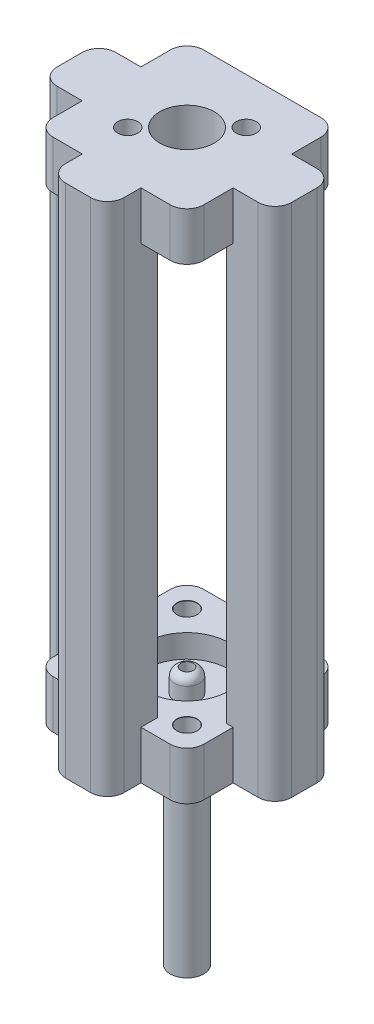
from build123d import *

# Parameters (mm, degrees)
SKETCH1_W                      = 18
SKETCH1_H                      = 18
BOSS_EXTRUDE1_DEPTH            = 5.75
M2_CLEARANCE_HOLE1_D           = 2.4
M2_CLEARANCE_HOLE1_CSINK_D     = 2.45
M2_CLEARANCE_HOLE1_CSINK_ANGLE = 90
SKETCH5_W                      = 5.8
SKETCH5_H                      = 7
BOSS_EXTRUDE2_DEPTH            = 50
SKETCH6_R                      = 4.0625
CUT_EXTRUDE1_DEPTH             = 5.75
SKETCH7_R                      = 3.25
CUT_EXTRUDE2_DEPTH             = 5.75
FILLET1_R                      = 2
M2_CLEARANCE_HOLE2_D           = 2.4
M2_CLEARANCE_HOLE2_DEPTH       = 5.75
M2_CLEARANCE_HOLE2_TIP         = 0.721032743
SKETCH11_W                     = 5
SKETCH11_H                     = 7
SKETCH11_W_2                   = 7
SKETCH11_H_2                   = 4
BOSS_EXTRUDE3_DEPTH            = 5.75
SKETCH12_W                     = 5
SKETCH12_H                     = 7
SKETCH12_W_2                   = 7
SKETCH12_H_2                   = 4
BOSS_EXTRUDE4_DEPTH            = 5.75
FILLET2_R                      = 2
SKETCH15_R                     = 4.0625
SKETCH15_R_2                   = 0.75
BOSS_EXTRUDE5_DEPTH            = 5.75
SKETCH16_R                     = 2
SKETCH16_R_2                   = 0.75
BOSS_EXTRUDE6_DEPTH            = 25
SKETCH17_R                     = 5
SKETCH17_R_2                   = 1.5
CUT_EXTRUDE3_DEPTH             = 2.75
CHAMFER1_SIZE                  = 0.25
CHAMFER1_SIZE2                 = 0.297408065
FILLET3_R                      = 1


with BuildPart() as part:
    # Sketch1 → Boss-Extrude1 (new body)
    with BuildSketch(Plane(origin=(0, 0, 0), x_dir=(1, 0, 0), z_dir=(0, 1, 0))):
        Rectangle(SKETCH1_W, SKETCH1_H)
    boss_extrude1 = extrude(amount=BOSS_EXTRUDE1_DEPTH)

    # M2 Clearance Hole1 (through all)
    with Locations(Plane(origin=(0, 5.75, 0), x_dir=(1, 0, 0), z_dir=(0, 1, 0))):
        with Locations((-6, 6), (6, 6), (-6, -6), (6, -6)):
            CounterSinkHole(M2_CLEARANCE_HOLE1_D / 2, M2_CLEARANCE_HOLE1_CSINK_D / 2, counter_sink_angle=M2_CLEARANCE_HOLE1_CSINK_ANGLE)

    # Sketch5 → Boss-Extrude2 (add)
    with BuildSketch(Plane(origin=(0, 5.75, 0), x_dir=(1, 0, 0), z_dir=(0, 1, 0))):
        with Locations((-11.1, 0)):
            Rectangle(SKETCH5_W, SKETCH5_H)
        with Locations((11.1, 0)):
            Rectangle(SKETCH5_W, SKETCH5_H)
        Polygon((3.5, -7), (1.5, -7), (1.5, -7.5), (-1.5, -7.5), (-1.5, -7), (-3.5, -7), (-3.5, -9), (-3.5, -13), (3.5, -13), (3.5, -9), align=None)
    extrude(amount=BOSS_EXTRUDE2_DEPTH)

    # Sketch6 → Cut-Extrude1 (cut)
    with BuildSketch(Plane(origin=(0, 5.75, 0), x_dir=(1, 0, 0), z_dir=(0, 1, 0))):
        with Locations(Location((0, 0, 0), (0, 0, 270))):
            Circle(SKETCH6_R)
    extrude(amount=-CUT_EXTRUDE1_DEPTH, mode=Mode.SUBTRACT)

    # Mirror1: Boss-Extrude1 across plane
    add(boss_extrude1.mirror(Plane.ZX.offset(30.75)))

    # Sketch7 → Cut-Extrude2 (cut)
    with BuildSketch(Plane(origin=(0, 61.5, 0), x_dir=(1, 0, 0), z_dir=(0, 1, 0))):
        with Locations(Location((0, 0, 0), (0, 0, 270))):
            Circle(SKETCH7_R)
    extrude(amount=-CUT_EXTRUDE2_DEPTH, mode=Mode.SUBTRACT)

    # Fillet1
    fillet1_edges = [part.edges().sort_by_distance(p)[0] for p in [
        (9, 58.625, -9),
        (9, 58.625, 9),
        (-9, 58.625, 9),
        (-9, 58.625, -9),
        (9, 2.875, 9),
        (-9, 2.875, 9),
        (-9, 2.875, -9),
        (9, 2.875, -9),
    ]]
    fillet(fillet1_edges, radius=FILLET1_R)

    # M2 Clearance Hole2
    with Locations(Plane(origin=(0, 61.5, 0), x_dir=(1, 0, 0), z_dir=(0, 1, 0))):
        with Locations((-3.535533906, -3.535533906), (3.535533906, 3.535533906)):
            Hole(M2_CLEARANCE_HOLE2_D / 2, depth=M2_CLEARANCE_HOLE2_DEPTH)
            with Locations((0, 0, -(M2_CLEARANCE_HOLE2_DEPTH + M2_CLEARANCE_HOLE2_TIP / 2))):  # 118° drill point
                Cone(0, M2_CLEARANCE_HOLE2_D / 2, M2_CLEARANCE_HOLE2_TIP, mode=Mode.SUBTRACT)

    # Sketch11 → Boss-Extrude3 (add)
    with BuildSketch(Plane(origin=(0, 55.75, 0), x_dir=(1, 0, 0), z_dir=(0, 1, 0))):
        with Locations((-11.5, 0)):
            Rectangle(SKETCH11_W, SKETCH11_H)
        with Locations((11.5, 0)):
            Rectangle(SKETCH11_W, SKETCH11_H)
        with Locations((0, -11)):
            Rectangle(SKETCH11_W_2, SKETCH11_H_2)
    extrude(amount=BOSS_EXTRUDE3_DEPTH)

    # Sketch12 → Boss-Extrude4 (add)
    with BuildSketch(Plane.XZ.offset(-5.75)):
        with Locations((-11.5, 0)):
            Rectangle(SKETCH12_W, SKETCH12_H)
        with Locations((0, 11)):
            Rectangle(SKETCH12_W_2, SKETCH12_H_2)
        with Locations((11.5, 0)):
            Rectangle(SKETCH12_W, SKETCH12_H)
    extrude(amount=BOSS_EXTRUDE4_DEPTH)

    # Fillet2
    fillet2_edges = [part.edges().sort_by_distance(p)[0] for p in [
        (-14, 30.75, -3.5),
        (-14, 30.75, 3.5),
        (-3.5, 30.75, 13),
        (3.5, 30.75, 13),
        (14, 30.75, -3.5),
        (14, 30.75, 3.5),
    ]]
    fillet(fillet2_edges, radius=FILLET2_R)

    # Sketch15 → Boss-Extrude5 (add)
    with BuildSketch(Plane(origin=(0, 5.75, 0), x_dir=(1, 0, 0), z_dir=(0, 1, 0))):
        Circle(SKETCH15_R)
        with Locations(Location((0, 0, 0), (0, 0, 270))):
            Circle(SKETCH15_R_2, mode=Mode.SUBTRACT)
    extrude(amount=-BOSS_EXTRUDE5_DEPTH)

    # Sketch16 → Boss-Extrude6 (add)
    with BuildSketch(Plane.XZ):
        with Locations(Location((0, 0, 0), (0, 0, 270))):
            Circle(SKETCH16_R)
        with Locations(Location((0, 0, 0), (0, 0, 90))):
            Circle(SKETCH16_R_2, mode=Mode.SUBTRACT)
    extrude(amount=BOSS_EXTRUDE6_DEPTH)

    # Sketch17 → Cut-Extrude3 (cut)
    with BuildSketch(Plane(origin=(0, 5.75, 0), x_dir=(1, 0, 0), z_dir=(0, 1, 0))):
        with Locations(Location((0, 0, 0), (0, 0, 270))):
            Circle(SKETCH17_R)
        with Locations(Location((0, 0, 0), (0, 0, 270))):
            Circle(SKETCH17_R_2, mode=Mode.SUBTRACT)
    extrude(amount=-CUT_EXTRUDE3_DEPTH, mode=Mode.SUBTRACT)

    # Sketch19 → Cut-Revolve1 (revolve, cut)
    with BuildSketch(Plane.XY, mode=Mode.PRIVATE) as cut_revolve1_sk:
        Polygon((0, -25), (-1.5, -25), (0, -15), align=None)
    revolve(cut_revolve1_sk.sketch.rotate(Axis((0, -15, 0), (0, -1, 0)), 270), axis=Axis((0, -15, 0), (0, -1, 0)), mode=Mode.SUBTRACT)

    # Chamfer1
    chamfer1_edges = [part.edges().sort_by_distance(p)[0] for p in [
        (0, -25, -1.5),
    ]]
    chamfer1_side = [part.faces().sort_by_distance(p)[0] for p in [
        (0, -22.5, -1.125),
    ]]
    chamfer(chamfer1_edges, length=CHAMFER1_SIZE, length2=CHAMFER1_SIZE2, reference=chamfer1_side[0])

    # Fillet3
    # the kernel refuses this fillet: 1 mm, written as the material it takes off along each edge
    with BuildSketch(Plane(origin=(0, 5.75, 0), x_dir=(0, 0, 1), z_dir=(-1, 0, 0))) as fillet3_piece_1:
        with BuildLine():
            CenterArc((0.5, -0.968245837), FILLET3_R, 0, 75.522487814)
            Line((1.5, -0.968245837), (1.52, -0.968245837))
            Line((1.52, -0.968245837), (1.52, 0))
            Line((1.52, 0), (1.5, 0.02))
            ThreePointArc((1.5, 0.02), (1.125, 0.02), (0.755, 0.019364917))
            Line((0.755, 0.019364917), (0.75, 0))
        make_face()
    revolve(axis=Axis((0, 5.75, 0), (0, 1, 0)), mode=Mode.SUBTRACT)


solid = part.part
